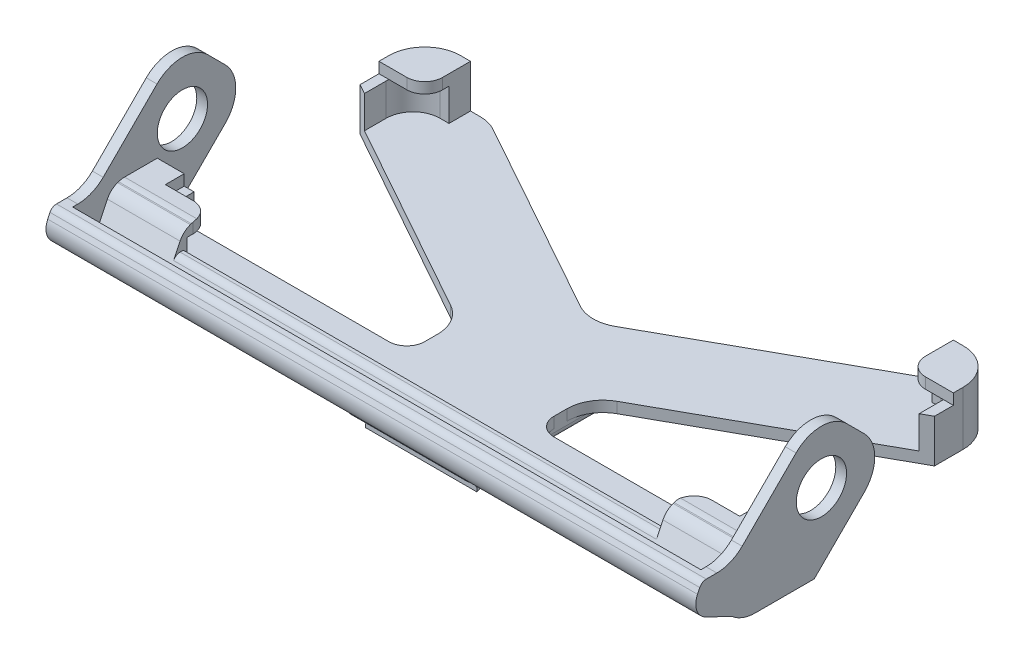
from build123d import *

# Parameters (mm, degrees)
EXTRUDE_1_DEPTH      = 4
CHAMFER_1_SIZE       = 3
CUT_EXTRUDE_1_DEPTH  = 33.687918257
SKETCH_3_R           = 9.557368967
EXTRUDE_2_DEPTH      = 3
CUT_EXTRUDE_2_DEPTH  = 2
SKETCH_7_R           = 2
CUT_EXTRUDE_3_DEPTH  = 34.188853551
FILLET_2_R           = 1
SKETCH_9_R           = 9.557368967
EXTRUDE_4_DEPTH      = 3
SKETCH_10_W          = 160
SKETCH_10_H          = 85
EXTRUDE_5_DEPTH      = 3
SKETCH_11_W          = 2.75
SKETCH_11_H          = 85
EXTRUDE_6_DEPTH      = 9
SKETCH_12_W          = 10
SKETCH_12_H          = 6
SKETCH_12_W_2        = 12.75
EXTRUDE_7_DEPTH      = 9
SKETCH_13_W          = 12.75
SKETCH_13_H          = 12.75
EXTRUDE_8_DEPTH      = 3
CUT_EXTRUDE_7_DEPTH  = 116.420968632
FILLET_3_R           = 7.5
SKETCH_22_W          = 18
SKETCH_22_H          = 15
EXTRUDE_9_DEPTH      = 7.5
SKETCH_23_R          = 7
EXTRUDE_10_DEPTH     = 3
EXTRUDE_START        = -67.25
EXTRUDE_11_DEPTH     = 134.5
EXTRUDE_12_DEPTH     = 23.25
EXTRUDE_13_DEPTH     = 23.25
CUT_EXTRUDE_START    = -87.5
CUT_EXTRUDE_10_DEPTH = 175
FILLET_4_R           = 10
FILLET_5_R           = 5
FILLET_6_R           = 2


# Some blends are built 0.0001 mm under size
with BuildPart() as part:
    # 草图1 → 凸台-拉伸1 (new body)
    with BuildSketch(Plane(origin=(0, 0, 0), x_dir=(1, 0, 0), z_dir=(0, 1, 0))):
        Polygon((-8, 28.5), (8, 28.5), (15.5, 0), (-15.5, 0), align=None)
    extrude(amount=EXTRUDE_1_DEPTH)

    # Chamfer 1
    chamfer_1_edges = [part.edges().sort_by_distance(p)[0] for p in [
        (11.75, 4, -14.25),
        (-11.75, 4, -14.25),
    ]]
    chamfer(chamfer_1_edges, length=CHAMFER_1_SIZE)

    # 草图2 → 切除-拉伸1 (cut, through all)
    with BuildSketch(Plane(origin=(0, 4, 0), x_dir=(1, 0, 0), z_dir=(0, 1, 0))):
        Polygon((-4.897860626, 28.5), (-9.315789474, 23.5), (-9.315789474, 28.5), align=None)
        Polygon((9.315789474, 28.5), (4.897860626, 28.5), (9.315789474, 23.5), align=None)
    extrude(amount=-CUT_EXTRUDE_1_DEPTH, mode=Mode.SUBTRACT)

    # 草图3 → 凸台-拉伸2 (add)
    with BuildSketch(Plane(origin=(0, 4, 0), x_dir=(1, 0, 0), z_dir=(0, 1, 0))):
        with Locations(Location((0, 9.557368967, 0), (0, 0, 270))):
            Circle(SKETCH_3_R)
    extrude(amount=EXTRUDE_2_DEPTH)

    # 草图5 → 切除-拉伸2 (cut)
    with BuildSketch(Plane.XZ):
        Polygon((-7.5, -24), (7.5, -24), (7.5, -22), (6, -22), (6, -4), (-6, -4), (-6, -22), (-7.5, -22), align=None)
    extrude(amount=-CUT_EXTRUDE_2_DEPTH, mode=Mode.SUBTRACT)

    # 草图7 → 切除-拉伸3 (cut, through all)
    with BuildSketch(Plane(origin=(0, 7, 0), x_dir=(1, 0, 0), z_dir=(0, 1, 0))):
        with Locations(Location((0, 9.557368967, 0), (0, 0, 270))):
            Circle(SKETCH_7_R)
    extrude(amount=-CUT_EXTRUDE_3_DEPTH, mode=Mode.SUBTRACT)

    # 草图8 → 切除-旋转1 (revolve, cut)
    with BuildSketch(Plane(origin=(0, 0, 0), x_dir=(0, 0, -1), z_dir=(1, 0, 0)), mode=Mode.PRIVATE) as cut_revolve_1_sk:
        Polygon((7.557368967, 5), (5.557368967, 3), (5.557368967, 2), (9.557368967, 2), (9.557368967, 5), align=None)
    revolve(cut_revolve_1_sk.sketch.rotate(Axis((0, -993, -9.557368967), (0, 1, 0)), 180), axis=Axis((0, -993, -9.557368967), (0, 1, 0)), mode=Mode.SUBTRACT)

    # 圆角2
    fillet_2_edges = [part.edges().sort_by_distance(p)[0] for p in [
        (-7.5, 1, -22),
        (-7.5, 1, -24),
        (7.5, 1, -24),
        (7.5, 1, -22),
    ]]
    fillet(fillet_2_edges, radius=FILLET_2_R - 0.0001)  # a hair under: the kernel refuses the full size

    # 草图9 → 凸台-拉伸4 (add)
    with BuildSketch(Plane(origin=(0, 4, 0), x_dir=(1, 0, 0), z_dir=(0, 1, 0))):
        Polygon((-18, -4), (18, -4), (18, 28.5), (18, 80.5), (-18, 80.5), (-18, 28.5), align=None)
        with Locations((0, 9.557368967)):
            Circle(SKETCH_9_R, mode=Mode.SUBTRACT)
    extrude(amount=EXTRUDE_4_DEPTH)

    # 草图10 → 凸台-拉伸5 (add)
    with BuildSketch(Plane(origin=(0, 7, 0), x_dir=(1, 0, 0), z_dir=(0, 1, 0))):
        with Locations((0, 38.5)):
            Rectangle(SKETCH_10_W, SKETCH_10_H)
    extrude(amount=EXTRUDE_5_DEPTH)

    # 草图11 → 凸台-拉伸6 (add)
    with BuildSketch(Plane(origin=(0, 10, 0), x_dir=(1, 0, 0), z_dir=(0, 1, 0))):
        with Locations((-78.625, 38.5)):
            Rectangle(SKETCH_11_W, SKETCH_11_H)
        with Locations((78.625, 38.5)):
            Rectangle(SKETCH_11_W, SKETCH_11_H)
    extrude(amount=EXTRUDE_6_DEPTH)

    # 草图12 → 凸台-拉伸7 (add)
    with BuildSketch(Plane(origin=(0, 10, 0), x_dir=(1, 0, 0), z_dir=(0, 1, 0))):
        with Locations((-72.25, 78)):
            Rectangle(SKETCH_12_W, SKETCH_12_H)
        with Locations((72.25, 78)):
            Rectangle(SKETCH_12_W, SKETCH_12_H)
        with Locations((73.625, -1)):
            Rectangle(SKETCH_12_W_2, SKETCH_12_H)
        with Locations((-73.625, -1)):
            Rectangle(SKETCH_12_W_2, SKETCH_12_H)
    extrude(amount=EXTRUDE_7_DEPTH)

    # 草图13 → 凸台-拉伸8 (add)
    with BuildSketch(Plane(origin=(0, 19, 0), x_dir=(1, 0, 0), z_dir=(0, 1, 0))):
        with Locations((-73.625, 74.625)):
            Rectangle(SKETCH_13_W, SKETCH_13_H)
        with Locations((-73.625, 2.375)):
            Rectangle(SKETCH_13_W, SKETCH_13_H)
        with Locations((73.625, 74.625)):
            Rectangle(SKETCH_13_W, SKETCH_13_H)
        with Locations((73.625, 2.375)):
            Rectangle(SKETCH_13_W, SKETCH_13_H)
    extrude(amount=EXTRUDE_8_DEPTH)

    # 草图21 → 切除-拉伸7 (cut, through all)
    with BuildSketch(Plane(origin=(0, 19, 0), x_dir=(1, 0, 0), z_dir=(0, 1, 0))):
        Polygon((-62, 81), (62, 81), (0, 46.5), align=None)
        Polygon((-80, 63), (-18, 28.5), (-18, 14), (-80, 14), align=None)
        Polygon((18, 14), (80, 14), (80, 63), (18, 28.5), align=None)
    extrude(amount=-CUT_EXTRUDE_7_DEPTH, mode=Mode.SUBTRACT)

    # 圆角3
    # the kernel refuses this fillet: 7.5 mm, written as the material it adds along each edge
    with BuildSketch(Plane(origin=(-77.25, 10, -75), x_dir=(1, 0, 0), z_dir=(0, 1, 0)), Plane(origin=(77.25, 10, -75), x_dir=(0, 0, 1), z_dir=(0, 1, 0)), Plane(origin=(77.25, 10, -2), x_dir=(-1, 0, 0), z_dir=(0, 1, 0)), Plane(origin=(-77.25, 19, -2), x_dir=(1, 0, 0), z_dir=(0, -1, 0))) as fillet_3_piece_1:
        with BuildLine():
            CenterArc((FILLET_3_R, -FILLET_3_R), FILLET_3_R, 90, 90)
            Line((0, -FILLET_3_R), (0, 0))
            Line((0, 0), (FILLET_3_R, 0))
        make_face()
    extrude(amount=9)

    # 草图22 → 凸台-拉伸9 (add)
    with BuildSketch(Plane(origin=(80, 0, 0), x_dir=(0, 0, -1), z_dir=(1, 0, 0))):
        with Locations((5, 14.5)):
            Rectangle(SKETCH_22_W, SKETCH_22_H)
    extrude_9 = extrude(amount=EXTRUDE_9_DEPTH)

    # 草图23 → 凸台-拉伸10 (add)
    with BuildSketch(Plane(origin=(87.5, 0, 0), x_dir=(0, 0, -1), z_dir=(1, 0, 0))):
        Polygon((-4, 7), (19, 7), (40, 28), (21, 47), (-4, 22), align=None)
        with Locations((21, 28)):
            Circle(SKETCH_23_R, mode=Mode.SUBTRACT)
    extrude_10 = extrude(amount=EXTRUDE_10_DEPTH)

    # 镜向1: 凸台-拉伸9, 凸台-拉伸10 across plane
    add(extrude_9.mirror(Plane(origin=(0, 0, 0), x_dir=(0, 0, 1), z_dir=(1, 0, 0))))
    add(extrude_10.mirror(Plane(origin=(0, 0, 0), x_dir=(0, 0, 1), z_dir=(1, 0, 0))))

    # 草图25 → 凸台-拉伸11 (add)
    with BuildSketch(Plane(origin=(0, 0, 0), x_dir=(0, 0, -1), z_dir=(1, 0, 0)).offset(EXTRUDE_START)):
        Polygon((-4, 12.234951563), (-12.333333333, 16.21488698), (-9.570408189, 22), (-12.340893658, 22), (-15.666666667, 15.036375678), (1, 7.076504844), (1, 16.417087553), (-1.154822031, 16.417087553), (-3.309644063, 11.905242918), align=None)
    extrude(amount=EXTRUDE_11_DEPTH)

    # 草图26 → 凸台-拉伸12 (add)
    with BuildSketch(Plane(origin=(67.25, 0, 0), x_dir=(0, 0, -1), z_dir=(1, 0, 0))):
        Polygon((-4, 9.464466094), (-15.666666667, 15.036375678), (-12.340893658, 22), (-4, 22), align=None)
    extrude(amount=EXTRUDE_12_DEPTH)

    # 草图27 → 凸台-拉伸13 (add)
    with BuildSketch(Plane.ZY.offset(67.25)):
        Polygon((4, 9.464466094), (15.666666667, 15.036375678), (12.340893658, 22), (4, 22), align=None)
    extrude(amount=EXTRUDE_13_DEPTH)

    # 草图24 → 切除-拉伸10 (cut)
    with BuildSketch(Plane(origin=(0, 0, 0), x_dir=(0, 0, -1), z_dir=(1, 0, 0)).offset(CUT_EXTRUDE_START)):
        Polygon((-12.333333333, 16.21488698), (-3.309644063, 11.905242918), (1, 20.928932188), (8.449087664, 23.562582388), (-9.320686958, 29.076014348), (-8.023689271, 25.238576251), align=None)
    extrude(amount=CUT_EXTRUDE_10_DEPTH, mode=Mode.SUBTRACT)

    # 圆角4
    # the kernel refuses this fillet: 10 mm, written as the material it adds along each edge
    with BuildSketch(Plane(origin=(18, 10, -28.5), x_dir=(0.873824666962511, 0, -0.48624114532591406), z_dir=(0, -1, 0)), Plane(origin=(-18, 10, -28.5), x_dir=(0, 0, 1), z_dir=(0, -1, 0))) as fillet_4_piece_1:
        with BuildLine():
            CenterArc((FILLET_4_R * 0.587942723636, FILLET_4_R), FILLET_4_R, 209.093820917, 60.906179083)
            Line((-FILLET_4_R * 0.285881943327, FILLET_4_R * 0.513758854674), (0, 0))
            Line((0, 0), (FILLET_4_R * 0.587942723636, 0))
        make_face()
    extrude(amount=3)
    with BuildSketch(Plane(origin=(0, 10, -46.5), x_dir=(-0.8738246669625115, 0, -0.48624114532591334), z_dir=(0, -1, 0))) as fillet_4_piece_2:
        with BuildLine():
            CenterArc((FILLET_4_R * 0.556451612903, FILLET_4_R), FILLET_4_R, 211.812358167, 58.187641833)
            Line((-FILLET_4_R * 0.293327400853, FILLET_4_R * 0.472860902816), (0, 0))
            Line((0, 0), (FILLET_4_R * 0.556451612903, 0))
        make_face()
    extrude(amount=6)
    with BuildSketch(Plane(origin=(87.5, 22, 4), x_dir=(0, 0, 1), z_dir=(1, 0, 0))) as fillet_4_piece_3:
        with BuildLine():
            CenterArc((FILLET_4_R * 0.414213562373, -FILLET_4_R), FILLET_4_R, 90, 45)
            Line((-FILLET_4_R * 0.292893218813, -FILLET_4_R * 0.292893218813), (0, 0))
            Line((0, 0), (FILLET_4_R * 0.414213562373, 0))
        make_face()
    extrude(amount=3)
    with BuildSketch(Plane(origin=(-87.5, 22, 4), x_dir=(0, 0, 1), z_dir=(-1, 0, 0))) as fillet_4_piece_4:
        with BuildLine():
            CenterArc((FILLET_4_R * 0.414213562373, FILLET_4_R), FILLET_4_R, 225, 45)
            Line((-FILLET_4_R * 0.292893218813, FILLET_4_R * 0.292893218813), (0, 0))
            Line((0, 0), (FILLET_4_R * 0.414213562373, 0))
        make_face()
    extrude(amount=3)
    # the kernel refuses this fillet: 10 mm, written as the material it takes off along each edge
    with BuildSketch(Plane(origin=(80, -18, -81), x_dir=(-1, 0, 0), z_dir=(0, 1, 0))) as fillet_4_2_piece_1:
        with BuildLine():
            CenterArc((FILLET_4_R, FILLET_4_R), FILLET_4_R, 180, 90)
            Line((0, FILLET_4_R), (0, 0))
            Line((0, 0), (FILLET_4_R, 0))
        make_face()
    extrude(amount=65, mode=Mode.SUBTRACT)
    with BuildSketch(Plane(origin=(-80, 47, -81), x_dir=(0, 0, 1), z_dir=(0, -1, 0))) as fillet_4_2_piece_2:
        with BuildLine():
            CenterArc((FILLET_4_R, -FILLET_4_R), FILLET_4_R, 90, 90)
            Line((0, -FILLET_4_R), (0, 0))
            Line((0, 0), (FILLET_4_R, 0))
        make_face()
    extrude(amount=65, mode=Mode.SUBTRACT)
    with BuildSketch(Plane(origin=(62, 16.487281787, -81), x_dir=(-0.8738246669625115, 0, 0.48624114532591345), z_dir=(0, -1, 0)), Plane(origin=(-62, 16.487281787, -81), x_dir=(-1, 0, 0), z_dir=(0, -1, 0))) as fillet_4_2_piece_3:
        with BuildLine():
            CenterArc((FILLET_4_R * 0.259491271461, -FILLET_4_R), FILLET_4_R, 90, 29.093820917)
            Line((-FILLET_4_R * 0.226749873864, -FILLET_4_R * 0.126175333037), (0, 0))
            Line((0, 0), (FILLET_4_R * 0.259491271461, 0))
        make_face()
    extrude(amount=15.974563573, mode=Mode.SUBTRACT)
    with BuildSketch(Plane(origin=(62.5, 28, -40), x_dir=(0, 0.7071067811865476, 0.7071067811865476), z_dir=(1, 0, 0)), Plane(origin=(62.5, 47, -21), x_dir=(0, -0.7071067811865476, 0.7071067811865476), z_dir=(1, 0, 0))) as fillet_4_2_piece_4:
        with BuildLine():
            CenterArc((FILLET_4_R, FILLET_4_R), FILLET_4_R, 180, 90)
            Line((0, FILLET_4_R), (0, 0))
            Line((0, 0), (FILLET_4_R, 0))
        make_face()
    extrude(amount=53, mode=Mode.SUBTRACT)
    with BuildSketch(Plane(origin=(-62.5, 47, -21), x_dir=(0, -0.7071067811865476, 0.7071067811865476), z_dir=(-1, 0, 0)), Plane(origin=(-62.5, 28, -40), x_dir=(0, 0.7071067811865476, 0.7071067811865476), z_dir=(-1, 0, 0))) as fillet_4_2_piece_5:
        with BuildLine():
            CenterArc((FILLET_4_R, -FILLET_4_R), FILLET_4_R, 90, 90)
            Line((0, -FILLET_4_R), (0, 0))
            Line((0, 0), (FILLET_4_R, 0))
        make_face()
    extrude(amount=53, mode=Mode.SUBTRACT)
    with BuildSketch(Plane(origin=(-106.93466777, 7, 4), x_dir=(0, 0, -1), z_dir=(1, 0, 0)), Plane(origin=(18, 7, 4), x_dir=(0, 0, -1), z_dir=(1, 0, 0))) as fillet_4_2_piece_6:
        with BuildLine():
            CenterArc((6.573867108, 10), FILLET_4_R, 228.899128275, 41.100871725)
            Line((0, 2.464466094), (0, 0))
            Line((0, 0), (6.573867108, 0))
        make_face()
    extrude(amount=88.93466777, mode=Mode.SUBTRACT)

    # 圆角5
    # the kernel refuses this fillet: 5 mm, written as the material it adds along each edge
    with BuildSketch(Plane(origin=(18, 10, -14), x_dir=(1, 0, 0), z_dir=(0, -1, 0)), Plane(origin=(-18, 10, -14), x_dir=(0, 0, -1), z_dir=(0, -1, 0))) as fillet_5_piece_1:
        with BuildLine():
            CenterArc((FILLET_5_R, -FILLET_5_R), FILLET_5_R, 90, 90)
            Line((0, -FILLET_5_R), (0, 0))
            Line((0, 0), (FILLET_5_R, 0))
        make_face()
    extrude(amount=3)
    # the kernel refuses this fillet: 5 mm, written as the material it takes off along each edge
    with BuildSketch(Plane(origin=(-67.25, 6.5, -68.25), x_dir=(0, 0, -1), z_dir=(0, 1, 0))) as fillet_5_2_piece_1_section:
        with BuildLine():
            CenterArc((FILLET_5_R, FILLET_5_R), FILLET_5_R, 180, 90)
            Line((0, FILLET_5_R), (0, 0))
            Line((0, 0), (FILLET_5_R, 0))
        make_face()
    fillet_5_2_piece_1 = extrude(amount=28, mode=Mode.PRIVATE)
    fillet_5_2_piece_1 = split(fillet_5_2_piece_1, bisect_by=Plane(origin=(-67.25, 10, -68.25), z_dir=(0, 1, 0)), keep=Keep.TOP, mode=Mode.PRIVATE)
    add(fillet_5_2_piece_1, mode=Mode.SUBTRACT)
    with BuildSketch(Plane(origin=(-67.25, 6.5, -8.75), x_dir=(-1, 0, 0), z_dir=(0, 1, 0))) as fillet_5_2_piece_2_section:
        with BuildLine():
            CenterArc((FILLET_5_R, FILLET_5_R), FILLET_5_R, 180, 90)
            Line((0, FILLET_5_R), (0, 0))
            Line((0, 0), (FILLET_5_R, 0))
        make_face()
    fillet_5_2_piece_2 = extrude(amount=28, mode=Mode.PRIVATE)
    fillet_5_2_piece_2 = split(fillet_5_2_piece_2, bisect_by=Plane(origin=(-67.25, 10, -8.75), z_dir=(0, 1, 0)), keep=Keep.TOP, mode=Mode.PRIVATE)
    add(fillet_5_2_piece_2, mode=Mode.SUBTRACT)
    with BuildSketch(Plane(origin=(67.25, 6.5, -68.25), x_dir=(1, 0, 0), z_dir=(0, 1, 0))) as fillet_5_2_piece_3_section:
        with BuildLine():
            CenterArc((FILLET_5_R, FILLET_5_R), FILLET_5_R, 180, 90)
            Line((0, FILLET_5_R), (0, 0))
            Line((0, 0), (FILLET_5_R, 0))
        make_face()
    fillet_5_2_piece_3 = extrude(amount=28, mode=Mode.PRIVATE)
    fillet_5_2_piece_3 = split(fillet_5_2_piece_3, bisect_by=Plane(origin=(67.25, 10, -68.25), z_dir=(0, 1, 0)), keep=Keep.TOP, mode=Mode.PRIVATE)
    add(fillet_5_2_piece_3, mode=Mode.SUBTRACT)
    with BuildSketch(Plane(origin=(67.25, 6.5, -8.75), x_dir=(0, 0, 1), z_dir=(0, 1, 0))) as fillet_5_2_piece_4_section:
        with BuildLine():
            CenterArc((FILLET_5_R, FILLET_5_R), FILLET_5_R, 180, 90)
            Line((0, FILLET_5_R), (0, 0))
            Line((0, 0), (FILLET_5_R, 0))
        make_face()
    fillet_5_2_piece_4 = extrude(amount=28, mode=Mode.PRIVATE)
    fillet_5_2_piece_4 = split(fillet_5_2_piece_4, bisect_by=Plane(origin=(67.25, 10, -8.75), z_dir=(0, 1, 0)), keep=Keep.TOP, mode=Mode.PRIVATE)
    add(fillet_5_2_piece_4, mode=Mode.SUBTRACT)
    with BuildSketch(Plane(origin=(103, 15.036375678, 15.666666667), x_dir=(0, 0.9023689270621944, -0.4309644062711259), z_dir=(-1, 0, 0))) as fillet_5_2_piece_5:
        with BuildLine():
            CenterArc((FILLET_5_R, FILLET_5_R), FILLET_5_R, 180, 90)
            Line((0, FILLET_5_R), (0, 0))
            Line((0, 0), (FILLET_5_R, 0))
        make_face()
    extrude(amount=206, mode=Mode.SUBTRACT)
    with BuildSketch(Plane(origin=(-65.105339059, 22, -4.029437252), x_dir=(0, 0, -1), z_dir=(-1, 0, 0)), Plane(origin=(87.5, 22, -4.029437252), x_dir=(0, 0, -1), z_dir=(-1, 0, 0))) as fillet_5_2_piece_6:
        with BuildLine():
            CenterArc((FILLET_5_R * 0.171572875254, FILLET_5_R), FILLET_5_R, 250.528779366, 19.471220634)
            Line((-FILLET_5_R * 0.16176045808, FILLET_5_R * 0.0571909584179), (0, 0))
            Line((0, 0), (FILLET_5_R * 0.171572875254, 0))
        make_face()
    extrude(amount=22.394660941, mode=Mode.SUBTRACT)
    with BuildSketch(Plane(origin=(62.07233047, 20.928932188, -1), x_dir=(0, 0.33333333333332904, -0.9428090415820649), z_dir=(1, 0, 0)), Plane(origin=(-87.5, 20.928932188, -1), x_dir=(0, 0.33333333333332904, -0.9428090415820649), z_dir=(1, 0, 0))) as fillet_5_2_piece_7:
        with BuildLine():
            CenterArc((FILLET_5_R * 0.414213562373, -FILLET_5_R), FILLET_5_R, 90, 45)
            Line((-FILLET_5_R * 0.292893218813, -FILLET_5_R * 0.292893218813), (0, 0))
            Line((0, 0), (FILLET_5_R * 0.414213562373, 0))
        make_face()
    extrude(amount=25.42766953, mode=Mode.SUBTRACT)

    # 圆角6
    # the kernel refuses this fillet: 2 mm, written as the material it takes off along each edge
    with BuildSketch(Plane(origin=(16, 6, 2), x_dir=(0, 0, 1), z_dir=(1, 0, 0))) as fillet_6_piece_1_section:
        Polygon((0, 0), (FILLET_6_R * 1.02, 0), (FILLET_6_R * 1.02, FILLET_6_R * 1.02), (0, FILLET_6_R * 1.02), align=None)
    fillet_6_piece_1 = extrude(amount=FILLET_6_R * 1.02, mode=Mode.PRIVATE)
    fillet_6_piece_1 = fillet_6_piece_1 - Plane(origin=(16, 6, 2), x_dir=(0, 0.7071067811865477, -0.7071067811865475), z_dir=(1, 0, 0)) * Sphere(FILLET_6_R, mode=Mode.PRIVATE)
    add(fillet_6_piece_1, mode=Mode.SUBTRACT)
    with BuildSketch(Plane(origin=(-16, 6, 2), x_dir=(0, 0, 1), z_dir=(-1, 0, 0))) as fillet_6_piece_2_section:
        Polygon((0, 0), (FILLET_6_R * 1.02, 0), (FILLET_6_R * 1.02, -FILLET_6_R * 1.02), (0, -FILLET_6_R * 1.02), align=None)
    fillet_6_piece_2 = extrude(amount=FILLET_6_R * 1.02, mode=Mode.PRIVATE)
    fillet_6_piece_2 = fillet_6_piece_2 - Plane(origin=(-16, 6, 2), x_dir=(0, 0.7071067811865477, -0.7071067811865475), z_dir=(-1, 0, 0)) * Sphere(FILLET_6_R, mode=Mode.PRIVATE)
    add(fillet_6_piece_2, mode=Mode.SUBTRACT)
    with BuildSketch(Plane(origin=(18, 6, 4), x_dir=(0, 0, -1), z_dir=(0, 1, 0))) as fillet_6_piece_3_section:
        with BuildLine():
            CenterArc((FILLET_6_R, FILLET_6_R), FILLET_6_R, 180, 90)
            Line((0, FILLET_6_R), (0, 0))
            Line((0, 0), (FILLET_6_R, 0))
        make_face()
    fillet_6_piece_3 = extrude(amount=8.464466094, mode=Mode.PRIVATE)
    fillet_6_piece_3 = fillet_6_piece_3 - Plane(origin=(18, 17, -2.573867108), x_dir=(0, 0, -1), z_dir=(-1, 0, 0)) * Cylinder(10, 25, mode=Mode.PRIVATE)
    add(fillet_6_piece_3, mode=Mode.SUBTRACT)
    with BuildSketch(Plane(origin=(18, 4, 2), x_dir=(0, 1, 0), z_dir=(0, 0, -1)), Plane(origin=(-18, 4, 2), x_dir=(1, 0, 0), z_dir=(0, 0, -1))) as fillet_6_piece_4:
        with BuildLine():
            CenterArc((FILLET_6_R, -FILLET_6_R), FILLET_6_R, 90, 90)
            Line((0, -FILLET_6_R), (0, 0))
            Line((0, 0), (FILLET_6_R, 0))
        make_face()
    extrude(amount=63.516129032, mode=Mode.SUBTRACT)
    with BuildSketch(Plane(origin=(-18, 6, 4), x_dir=(1, 0, 0), z_dir=(0, 1, 0))) as fillet_6_piece_5_section:
        with BuildLine():
            CenterArc((FILLET_6_R, FILLET_6_R), FILLET_6_R, 180, 90)
            Line((0, FILLET_6_R), (0, 0))
            Line((0, 0), (FILLET_6_R, 0))
        make_face()
    fillet_6_piece_5 = extrude(amount=8.464466094, mode=Mode.PRIVATE)
    fillet_6_piece_5 = fillet_6_piece_5 - Plane(origin=(-18, 17, -2.573867108), x_dir=(0, 0, -1), z_dir=(-1, 0, 0)) * Cylinder(10, 25, mode=Mode.PRIVATE)
    add(fillet_6_piece_5, mode=Mode.SUBTRACT)
    with BuildSketch(Plane(origin=(-16, 4, 4), x_dir=(0, 1, 0), z_dir=(1, 0, 0))) as fillet_6_piece_6:
        with BuildLine():
            CenterArc((FILLET_6_R, -FILLET_6_R), FILLET_6_R, 90, 90)
            Line((0, -FILLET_6_R), (0, 0))
            Line((0, 0), (FILLET_6_R, 0))
        make_face()
    extrude(amount=32, mode=Mode.SUBTRACT)
    with BuildSketch(Plane(origin=(-18, -4.504229747, -56.516129032), x_dir=(0.873824666962511, 0, 0.48624114532591417), z_dir=(0, 1, 0))) as fillet_6_piece_7:
        with BuildLine():
            CenterArc((FILLET_6_R * 1.70084594944, -FILLET_6_R), FILLET_6_R, 90, 119.093820917)
            Line((FILLET_6_R * 0.82702128248, -FILLET_6_R * 1.48624114533), (0, 0))
            Line((0, 0), (FILLET_6_R * 1.70084594944, 0))
        make_face()
    extrude(amount=11.504229747, mode=Mode.SUBTRACT)
    with BuildSketch(Plane(origin=(18, 7, -56.516129032), x_dir=(0, 0, 1), z_dir=(0, -1, 0))) as fillet_6_piece_8:
        with BuildLine():
            CenterArc((FILLET_6_R * 1.70084594944, FILLET_6_R), FILLET_6_R, 150.906179083, 119.093820917)
            Line((FILLET_6_R * 0.82702128248, FILLET_6_R * 1.48624114533), (0, 0))
            Line((0, 0), (FILLET_6_R * 1.70084594944, 0))
        make_face()
    extrude(amount=11.504229747, mode=Mode.SUBTRACT)
    with BuildSketch(Plane(origin=(-93.653009687, 22, 12.340893658), x_dir=(0, 0, -1), z_dir=(1, 0, 0))) as fillet_6_piece_9:
        with BuildLine():
            CenterArc((FILLET_6_R * 0.630601937482, -FILLET_6_R), FILLET_6_R, 90, 64.471220634)
            Line((-FILLET_6_R * 0.27176698958, -FILLET_6_R * 0.569035593729), (0, 0))
            Line((0, 0), (FILLET_6_R * 0.630601937482, 0))
        make_face()
    extrude(amount=187.306019375, mode=Mode.SUBTRACT)
    with BuildSketch(Plane(origin=(-67.25, 16.417087553, 1.154822031), x_dir=(0, -0.9023689270621896, 0.43096440627113614), z_dir=(1, 0, 0))) as fillet_6_piece_10:
        with BuildLine():
            CenterArc((FILLET_6_R * 0.630601937482, FILLET_6_R), FILLET_6_R, 205.528779366, 64.471220634)
            Line((-FILLET_6_R * 0.27176698958, FILLET_6_R * 0.569035593729), (0, 0))
            Line((0, 0), (FILLET_6_R * 0.630601937482, 0))
        make_face()
    extrude(amount=134.5, mode=Mode.SUBTRACT)


solid = part.part
